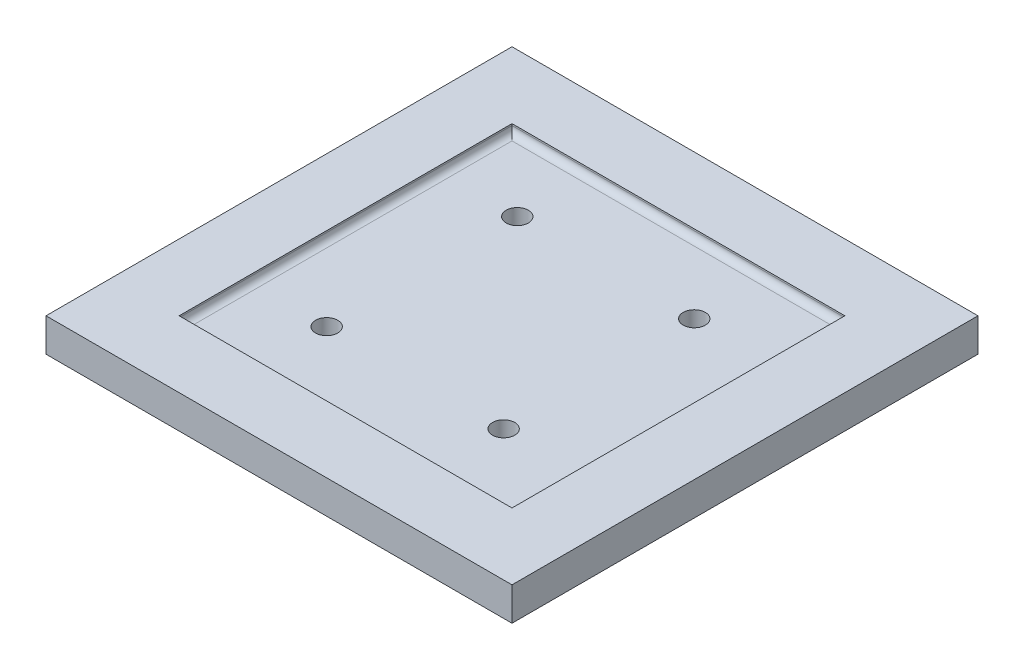
from build123d import *

# Parameters (mm, degrees)
SKETCH10_W          = 177.8
SKETCH10_H          = 177.8
BOSS_EXTRUDE4_DEPTH = 12.7
SKETCH12_W          = 127
SKETCH12_H          = 127
BOSS_EXTRUDE5_DEPTH = 3.175
SKETCH13_W          = 127
SKETCH13_H          = 127
CUT_EXTRUDE1_DEPTH  = 3.175
SKETCH14_W          = 127
SKETCH14_H          = 127
CUT_EXTRUDE2_DEPTH  = 3.175
FILLET4_R           = 2.54
SKETCH16_R          = 2.794
CUT_EXTRUDE3_DEPTH  = 25.4
SCALE1_SCALE        = 0.75
SKETCH17_R          = 3.175
CUT_EXTRUDE5_DEPTH  = 15.748


with BuildPart() as part:
    # Sketch10 → Boss-Extrude4 (new body)
    with BuildSketch(Plane(origin=(0, 0, 0), x_dir=(1, 0, 0), z_dir=(0, 1, 0))):
        Rectangle(SKETCH10_W, SKETCH10_H)
    extrude(amount=BOSS_EXTRUDE4_DEPTH)

    # Sketch12 → Boss-Extrude5 (add)
    with BuildSketch(Plane(origin=(0, 12.7, 0), x_dir=(1, 0, 0), z_dir=(0, 1, 0))):
        Rectangle(SKETCH12_W, SKETCH12_H)
    extrude(amount=-BOSS_EXTRUDE5_DEPTH)

    # Sketch13 → Cut-Extrude1 (cut)
    with BuildSketch(Plane(origin=(0, 12.7, 0), x_dir=(1, 0, 0), z_dir=(0, 1, 0))):
        Rectangle(SKETCH13_W, SKETCH13_H)
    extrude(amount=-CUT_EXTRUDE1_DEPTH, mode=Mode.SUBTRACT)

    # Sketch14 → Cut-Extrude2 (cut)
    with BuildSketch(Plane(origin=(0, 0, 0), x_dir=(-1, 0, 0), z_dir=(0, -1, 0))):
        Rectangle(SKETCH14_W, SKETCH14_H)
    extrude(amount=-CUT_EXTRUDE2_DEPTH, mode=Mode.SUBTRACT)

    # Fillet4
    fillet4_edges = [part.edges().sort_by_distance(p)[0] for p in [
        (-63.5, 9.525, 0),
        (0, 9.525, 63.5),
        (0, 9.525, -63.5),
        (63.5, 9.525, 0),
        (0, 3.175, 63.5),
        (-63.5, 3.175, 0),
        (0, 3.175, -63.5),
        (63.5, 3.175, 0),
    ]]
    fillet(fillet4_edges, radius=FILLET4_R)

    # Sketch16 → Cut-Extrude3 (cut)
    with BuildSketch(Plane(origin=(0, 9.525, 0), x_dir=(1, 0, 0), z_dir=(0, 1, 0))):
        with Locations((-34.945581996, 36.952591773)):
            Circle(SKETCH16_R)
        with Locations((32.584394023, 36.952591773)):
            Circle(SKETCH16_R)
        with Locations((-34.945581996, -35.771997786)):
            Circle(SKETCH16_R)
        with Locations((32.584394023, -35.771997786)):
            Circle(SKETCH16_R)
    extrude(amount=-CUT_EXTRUDE3_DEPTH, mode=Mode.SUBTRACT)


with BuildPart() as part_1:
    # Scale1: scaled about (0.002452757, 6.35, 0.001226378)
    add(part.part.scale(SCALE1_SCALE).moved(Location((0.000613189, 1.5875, 0.000306594))))

    # Sketch17 → Cut-Extrude5 (cut)
    with BuildSketch(Plane(origin=(0, 8.73125, 0), x_dir=(1, 0, 0), z_dir=(0, 1, 0))):
        with Locations((-26.208573303, 27.714137232)):
            Circle(SKETCH17_R)
        with Locations((24.438908712, 27.714137232)):
            Circle(SKETCH17_R)
        with Locations((-26.208573303, -26.829304937)):
            Circle(SKETCH17_R)
        with Locations((24.438908712, -26.829304937)):
            Circle(SKETCH17_R)
    extrude(amount=-CUT_EXTRUDE5_DEPTH, mode=Mode.SUBTRACT)


solid = part_1.part
